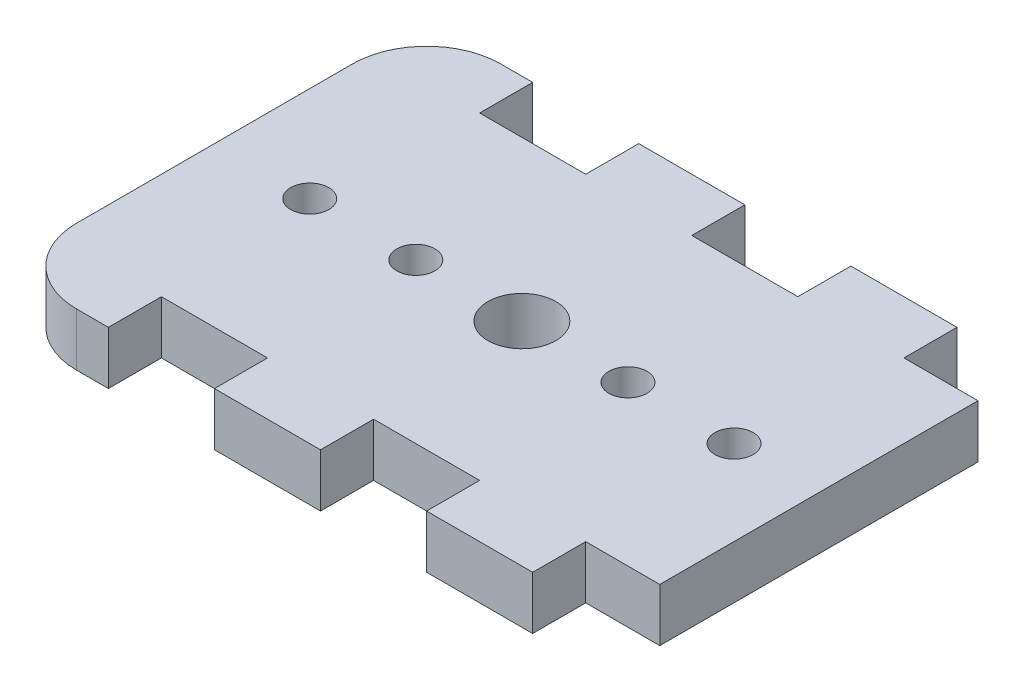
from build123d import *

# Parameters (mm, degrees)
MAIN_DEPTH             = 6.35
SKETCH3_R              = 4.064
SKETCH3_R_2            = 2.286
GEAR_MOUNT_HOLES_DEPTH = 51.497474194
SKETCH4_W              = 5.978415147
SKETCH4_H              = 38.1
SKETCH4_W_2            = 8.0137
CUT_EXTRUDE2_DEPTH     = 51.497474194
FILLET1_R              = 8.89


with BuildPart() as part:
    # Sketch1 → Main (new body)
    with BuildSketch(Plane(origin=(0, 0, 0), x_dir=(1, 0, 0), z_dir=(0, 1, 0))):
        Polygon((-43.18, 19.05), (-35.1663, 19.05), (-35.1663, 25.4), (-22.4663, 25.4), (-22.4663, 19.05), (-9.7663, 19.05), (-9.7663, 25.4), (2.9337, 25.4), (2.9337, 19.05), (15.6337, 19.05), (15.6337, 25.4), (28.3337, 25.4), (28.3337, 19.05), (43.18, 19.05), (43.18, -19.05), (28.3337, -19.05), (28.3337, -25.4), (15.6337, -25.4), (15.6337, -19.05), (2.9337, -19.05), (2.9337, -25.4), (-9.7663, -25.4), (-9.7663, -19.05), (-22.4663, -19.05), (-22.4663, -25.4), (-35.1663, -25.4), (-35.1663, -19.05), (-43.18, -19.05), align=None)
    extrude(amount=MAIN_DEPTH)

    # Sketch3 → Gear Mount Holes (cut, through all)
    with BuildSketch(Plane(origin=(0, 6.35, 0), x_dir=(1, 0, 0), z_dir=(0, 1, 0))):
        with Locations((1.641584853, 0)):
            Circle(SKETCH3_R)
        with Locations((14.341584853, 0)):
            Circle(SKETCH3_R_2)
        with Locations((27.041584853, 0)):
            Circle(SKETCH3_R_2)
        with Locations((-11.058415147, 0)):
            Circle(SKETCH3_R_2)
        with Locations((-23.758415147, 0)):
            Circle(SKETCH3_R_2)
    extrude(amount=-GEAR_MOUNT_HOLES_DEPTH, mode=Mode.SUBTRACT)

    # Sketch4 → Cut-Extrude2 (cut, through all)
    with BuildSketch(Plane(origin=(0, 6.35, 0), x_dir=(1, 0, 0), z_dir=(0, 1, 0))):
        with Locations((40.190792426, 0)):
            Rectangle(SKETCH4_W, SKETCH4_H)
        with Locations((-39.17315, 0)):
            Rectangle(SKETCH4_W_2, SKETCH4_H)
    extrude(amount=-CUT_EXTRUDE2_DEPTH, mode=Mode.SUBTRACT)

    # Fillet1
    fillet1_edges = [part.edges().sort_by_distance(p)[0] for p in [
        (-35.1663, 3.175, -25.4),
        (-35.1663, 3.175, 25.4),
    ]]
    fillet(fillet1_edges, radius=FILLET1_R)


solid = part.part
